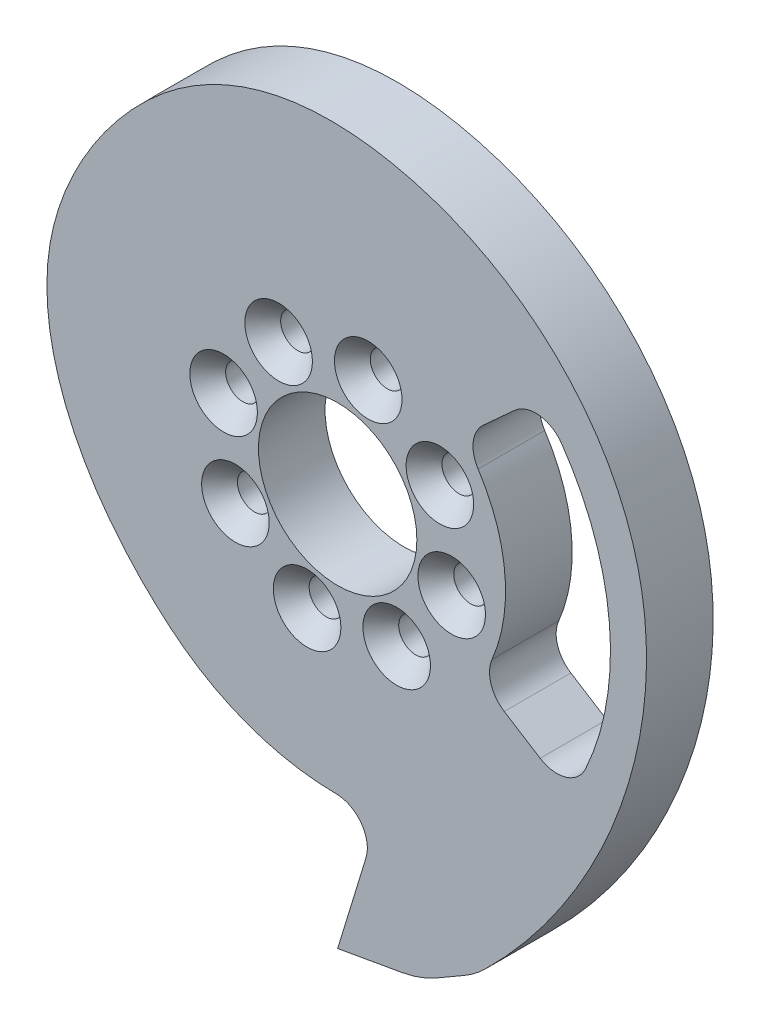
from build123d import *
from OCP.BRepFilletAPI import BRepFilletAPI_MakeFillet

# Parameters (mm, degrees)
SKETCH1_R                                        = 15.1
BOSS_EXTRUDE1_DEPTH                              = 12.7
FILLET1_R1                                       = 6
FILLET1_R2                                       = 20
CUT_EXTRUDE1_DEPTH                               = 97.187316036
FILLET2_R                                        = 6
CSK_FOR_1_4_FLAT_HEAD_MACHINE_SCREW1_D           = 6.5278
CSK_FOR_1_4_FLAT_HEAD_MACHINE_SCREW1_DEPTH       = 54.11
CSK_FOR_1_4_FLAT_HEAD_MACHINE_SCREW1_CSINK_D     = 12.8778
CSK_FOR_1_4_FLAT_HEAD_MACHINE_SCREW1_CSINK_ANGLE = 82
CSK_FOR_1_4_FLAT_HEAD_MACHINE_SCREW1_TIP         = 1.961148974


with BuildPart() as part:
    # Sketch1 → Boss-Extrude1 (new body)
    with BuildSketch(Plane.XY):
        with BuildLine():
            ThreePointArc((-31.88226544, -37.995804379), (-13.155899314, -47.823449407), (7.962221644, -48.956746486))
            Line((7.962221644, -48.956746486), (0, -75))
            Line((0, -75), (15.756924048, -72.221629157))
            Line((15.756924048, -72.221629157), (26.149228894, -66.221629157))
            add(Edge.make_bspline(
                [(26.149228894, -66.221629157), (51.375242172, -42.5711118), (73.155327324, 16.265957691), (24.786084456, 64.170295229), (-29.726149903, 61.426673461), (-65.053373901, 8.823513537), (-48.308937171, -24.212190188), (-31.88226544, -37.995804379)],
                knots=[0, 0, 0, 0, 0.320521396, 0.565793749, 0.734822836, 0.843782163, 1, 1, 1, 1], degree=3))
        make_face()
        Circle(SKETCH1_R, mode=Mode.SUBTRACT)
    extrude(amount=BOSS_EXTRUDE1_DEPTH)

    # Fillet1: one fillet with a radius per group of edges: ONE call of the kernel's fillet builder (fillet() takes one radius for all edges)
    fillet1_edges_1 = [part.edges().sort_by_distance(p)[0] for p in [
        (7.962221644, -48.956746486, 6.35),
    ]]
    fillet1_edges_2 = [part.edges().sort_by_distance(p)[0] for p in [
        (15.756924048, -72.221629157, 6.35),
        (26.149228894, -66.221629157, 6.35),
    ]]
    fillet1 = BRepFilletAPI_MakeFillet(part.part.solid().wrapped)
    for e in fillet1_edges_1:
        fillet1.Add(FILLET1_R1, e.wrapped)
    for e in fillet1_edges_2:
        fillet1.Add(FILLET1_R2, e.wrapped)
    add(Compound.cast(fillet1.Shape()), mode=Mode.REPLACE)

    # Sketch2 → Cut-Extrude1 (cut, through all)
    with BuildSketch(Plane.XY.offset(12.7)):
        with BuildLine():
            Line((38.459406213, 34.998201007), (23.6673269, 21.537354466))
            ThreePointArc((23.6673269, 21.537354466), (31.875670784, 2.818086599), (27.078868652, -17.050949314))
            Line((27.078868652, -17.050949314), (44.00316156, -27.707792636))
            ThreePointArc((44.00316156, -27.707792636), (51.797965024, 4.579390723), (38.459406213, 34.998201007))
        make_face()
    extrude(amount=-CUT_EXTRUDE1_DEPTH, mode=Mode.SUBTRACT)

    # Fillet2
    fillet2_edges = [part.edges().sort_by_distance(p)[0] for p in [
        (27.078868652, -17.050949314, 6.35),
        (38.459406213, 34.998201007, 6.35),
        (44.00316156, -27.707792636, 6.35),
        (23.6673269, 21.537354466, 6.35),
    ]]
    fillet(fillet2_edges, radius=FILLET2_R)

    # CSK for 1/4 Flat Head Machine Screw1
    with Locations(Plane.XY.offset(12.7)):
        with Locations((19.485571585, 11.25), (21.733331092, -5.823428515), (11.25, -19.485571585), (-5.823428515, -21.733331092), (-11.25, 19.485571585), (5.823428515, 21.733331092), (-19.485571585, -11.25), (-21.733331092, 5.823428515)):
            CounterSinkHole(CSK_FOR_1_4_FLAT_HEAD_MACHINE_SCREW1_D / 2, CSK_FOR_1_4_FLAT_HEAD_MACHINE_SCREW1_CSINK_D / 2, depth=CSK_FOR_1_4_FLAT_HEAD_MACHINE_SCREW1_DEPTH, counter_sink_angle=CSK_FOR_1_4_FLAT_HEAD_MACHINE_SCREW1_CSINK_ANGLE)
            with Locations((0, 0, -(CSK_FOR_1_4_FLAT_HEAD_MACHINE_SCREW1_DEPTH + CSK_FOR_1_4_FLAT_HEAD_MACHINE_SCREW1_TIP / 2))):  # 118° drill point
                Cone(0, CSK_FOR_1_4_FLAT_HEAD_MACHINE_SCREW1_D / 2, CSK_FOR_1_4_FLAT_HEAD_MACHINE_SCREW1_TIP, mode=Mode.SUBTRACT)


solid = part.part
